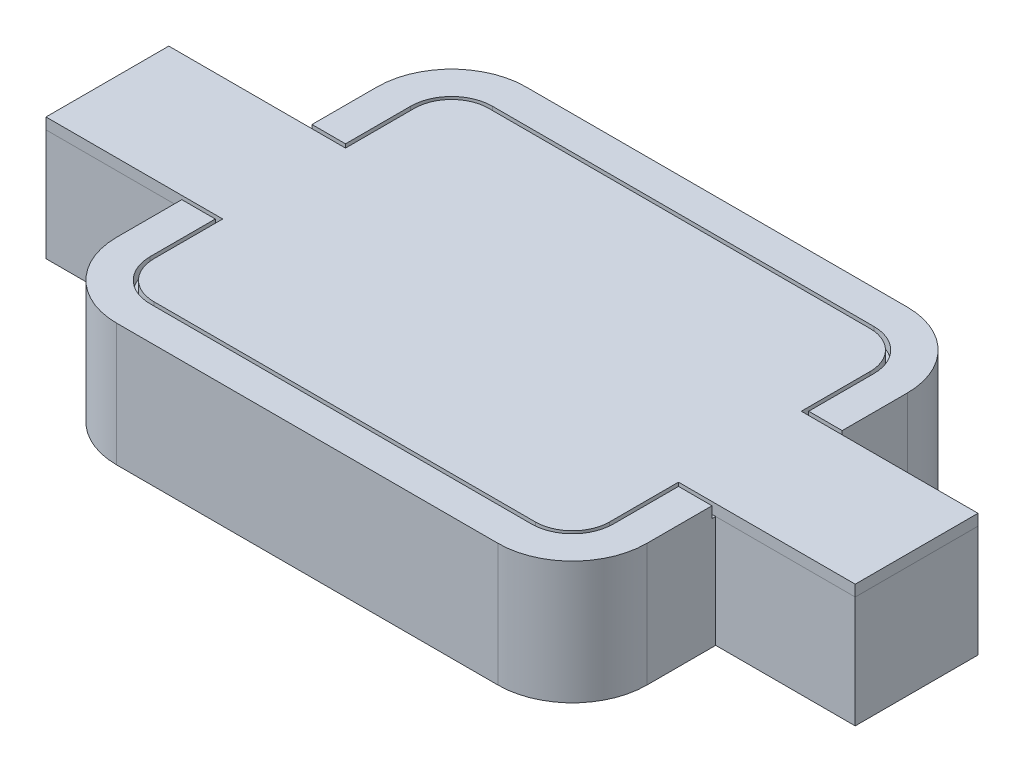
from build123d import *

# Parameters (mm, degrees)
BOSS_EXTRUDE1_DEPTH = 6.6
CUT_EXTRUDE1_DEPTH  = 0.6
CUT_EXTRUDE2_DEPTH  = 1.5
MAGNETHOLE_REACH    = 27.851
MAGNETHOLE_START    = 0.6
SKETCH4_R           = 2.6
PCB_DEPTH           = 0.6


with BuildPart() as part:
    # Sketch1 → Boss-Extrude1 (new body)
    with BuildSketch(Plane(origin=(0, 0, 0), x_dir=(1, 0, 0), z_dir=(0, 1, 0))):
        with BuildLine():
            Line((-14.25, 7), (-14.25, 3.3))
            Line((-14.25, 3.3), (-21.75, 3.3))
            Line((-21.75, 3.3), (-21.75, -3.3))
            Line((-21.75, -3.3), (-14.25, -3.3))
            Line((-14.25, -3.3), (-14.25, -7))
            ThreePointArc((-14.25, -7), (-13.078427125, -9.828427125), (-10.25, -11))
            Line((-10.25, -11), (10.25, -11))
            ThreePointArc((10.25, -11), (13.078427125, -9.828427125), (14.25, -7))
            Line((14.25, -7), (14.25, -3.3))
            Line((14.25, -3.3), (21.75, -3.3))
            Line((21.75, -3.3), (21.75, 3.3))
            Line((21.75, 3.3), (14.25, 3.3))
            Line((14.25, 3.3), (14.25, 7))
            ThreePointArc((14.25, 7), (13.078427125, 9.828427125), (10.25, 11))
            Line((10.25, 11), (-10.25, 11))
            ThreePointArc((-10.25, 11), (-13.078427125, 9.828427125), (-14.25, 7))
        make_face()
    extrude(amount=BOSS_EXTRUDE1_DEPTH)

    # Sketch2 → Cut-Extrude1 (cut)
    with BuildSketch(Plane(origin=(0, 6.6, 0), x_dir=(1, 0, 0), z_dir=(0, 1, 0))):
        with BuildLine():
            Line((-21.75, 3.5), (-12.45, 3.5))
            Line((-12.45, 3.5), (-12.45, 7))
            ThreePointArc((-12.45, 7), (-11.805634919, 8.555634919), (-10.25, 9.2))
            Line((-10.25, 9.2), (10.25, 9.2))
            ThreePointArc((10.25, 9.2), (11.805634919, 8.555634919), (12.45, 7))
            Line((12.45, 7), (12.45, 3.5))
            Line((12.45, 3.5), (21.75, 3.5))
            Line((21.75, 3.5), (21.75, -3.5))
            Line((21.75, -3.5), (12.45, -3.5))
            Line((12.45, -3.5), (12.45, -7))
            ThreePointArc((12.45, -7), (11.805634919, -8.555634919), (10.25, -9.2))
            Line((10.25, -9.2), (-10.25, -9.2))
            ThreePointArc((-10.25, -9.2), (-11.805634919, -8.555634919), (-12.45, -7))
            Line((-12.45, -7), (-12.45, -3.5))
            Line((-12.45, -3.5), (-21.75, -3.5))
            Line((-21.75, -3.5), (-21.75, 3.5))
        make_face()
    extrude(amount=-CUT_EXTRUDE1_DEPTH, mode=Mode.SUBTRACT)

    # Sketch3 → Cut-Extrude2 (cut)
    with BuildSketch(Plane(origin=(0, 6, 0), x_dir=(1, 0, 0), z_dir=(0, 1, 0))):
        with BuildLine():
            ThreePointArc((-8.45, 7.2), (-9.864213562, 6.614213562), (-10.45, 5.2))
            Line((-10.45, 5.2), (-10.45, -5.2))
            ThreePointArc((-10.45, -5.2), (-9.864213562, -6.614213562), (-8.45, -7.2))
            Line((-8.45, -7.2), (8.45, -7.2))
            ThreePointArc((8.45, -7.2), (9.864213562, -6.614213562), (10.45, -5.2))
            Line((10.45, -5.2), (10.45, 5.2))
            ThreePointArc((10.45, 5.2), (9.864213562, 6.614213562), (8.45, 7.2))
            Line((8.45, 7.2), (-8.45, 7.2))
        make_face()
    extrude(amount=-CUT_EXTRUDE2_DEPTH, mode=Mode.SUBTRACT)

    # Sketch4 → MagnetHole (cut, up to next)
    with BuildSketch(Plane(origin=(0, 0, 0), x_dir=(1, 0, 0), z_dir=(0, 1, 0)).offset(MAGNETHOLE_START), mode=Mode.PRIVATE) as magnethole_sk1:
        with Locations((-18, 0)):
            Circle(SKETCH4_R)
    magnethole_tool1 = extrude(magnethole_sk1.sketch, amount=MAGNETHOLE_REACH, mode=Mode.PRIVATE) & part.part
    # Sketch4 → MagnetHole (cut, up to next)
    with BuildSketch(Plane(origin=(0, 0, 0), x_dir=(1, 0, 0), z_dir=(0, 1, 0)).offset(MAGNETHOLE_START), mode=Mode.PRIVATE) as magnethole_sk2:
        with Locations((18, 0)):
            Circle(SKETCH4_R)
    magnethole_tool2 = extrude(magnethole_sk2.sketch, amount=MAGNETHOLE_REACH, mode=Mode.PRIVATE) & part.part
    add(magnethole_tool1.solids().sort_by_distance((-18, 0.6, 0))[0], mode=Mode.SUBTRACT)
    add(magnethole_tool2.solids().sort_by_distance((18, 0.6, 0))[0], mode=Mode.SUBTRACT)


with BuildPart() as body_2:
    # Sketch5 → PCB (new body)
    with BuildSketch(Plane(origin=(0, 6, 0), x_dir=(1, 0, 0), z_dir=(0, 1, 0))):
        with BuildLine():
            Line((12.25, 3.3), (14.25, 3.3))
            Line((14.25, 3.3), (21.75, 3.3))
            Line((21.75, 3.3), (21.75, -3.3))
            Line((21.75, -3.3), (14.25, -3.3))
            Line((14.25, -3.3), (12.25, -3.3))
            Line((12.25, -3.3), (12.25, -7))
            ThreePointArc((12.25, -7), (11.664213562, -8.414213562), (10.25, -9))
            Line((10.25, -9), (-10.25, -9))
            ThreePointArc((-10.25, -9), (-11.664213562, -8.414213562), (-12.25, -7))
            Line((-12.25, -7), (-12.25, -3.3))
            Line((-12.25, -3.3), (-14.25, -3.3))
            Line((-14.25, -3.3), (-21.75, -3.3))
            Line((-21.75, -3.3), (-21.75, 3.3))
            Line((-21.75, 3.3), (-14.25, 3.3))
            Line((-14.25, 3.3), (-12.25, 3.3))
            Line((-12.25, 3.3), (-12.25, 7))
            ThreePointArc((-12.25, 7), (-11.664213562, 8.414213562), (-10.25, 9))
            Line((-10.25, 9), (10.25, 9))
            ThreePointArc((10.25, 9), (11.664213562, 8.414213562), (12.25, 7))
            Line((12.25, 7), (12.25, 3.3))
        make_face()
    extrude(amount=PCB_DEPTH)


solid = Compound([part.part, body_2.part])
